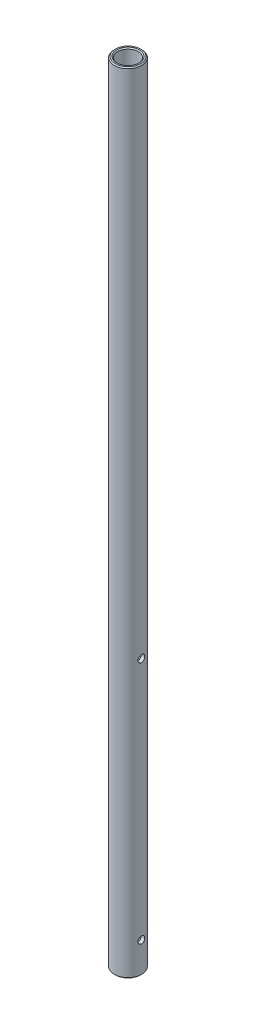
from build123d import *

# Parameters (mm, degrees)
SKETCH_1_R               = 4
SKETCH_1_R_2             = 3
EXTRUDE_1_DEPTH          = 230
CHAMFER_1_SIZE           = 0.3
CUT_EXTRUDE_1_DEPTH      = 231.0695547
CUT_EXTRUDE_1_DEPTH_BACK = 231.0695547
SKETCH_2_R               = 1
CUT_EXTRUDE_2_DEPTH      = 231.069554704
CUT_EXTRUDE_2_DEPTH_BACK = 231.069554704
SKETCH_3_R               = 1


with BuildPart() as part:
    # Эскиз1 → Бобышка-Вытянуть1 (new body)
    with BuildSketch(Plane(origin=(0, 0, 0), x_dir=(1, 0, 0), z_dir=(0, 1, 0))):
        Circle(SKETCH_1_R)
        Circle(SKETCH_1_R_2, mode=Mode.SUBTRACT)
    extrude(amount=EXTRUDE_1_DEPTH)

    # Фаска1
    chamfer_1_edges = [part.edges().sort_by_distance(p)[0] for p in [
        (-3, 230, 0),
        (-3, 0, 0),
        (-4, 0, 0),
        (-4, 230, 0),
    ]]
    chamfer(chamfer_1_edges, length=CHAMFER_1_SIZE)

    # Эскиз2 → Вырез-Вытянуть1 (cut, two sides: drawn at the far end of the back side and taken through both)
    with BuildSketch(Plane(origin=(0, 0, 0), x_dir=(0, 0, -1), z_dir=(1, 0, 0)).offset(-CUT_EXTRUDE_1_DEPTH_BACK)):
        with Locations((0, 9)):
            Circle(SKETCH_2_R)
    extrude(amount=CUT_EXTRUDE_1_DEPTH + CUT_EXTRUDE_1_DEPTH_BACK, mode=Mode.SUBTRACT)

    # Эскиз3 → Вырез-Вытянуть2 (cut, two sides: drawn at the far end of the back side and taken through both)
    with BuildSketch(Plane(origin=(0, 0, 0), x_dir=(0, 0, -1), z_dir=(1, 0, 0)).offset(-CUT_EXTRUDE_2_DEPTH_BACK)):
        with Locations((0, 80)):
            Circle(SKETCH_3_R)
    extrude(amount=CUT_EXTRUDE_2_DEPTH + CUT_EXTRUDE_2_DEPTH_BACK, mode=Mode.SUBTRACT)


solid = part.part
